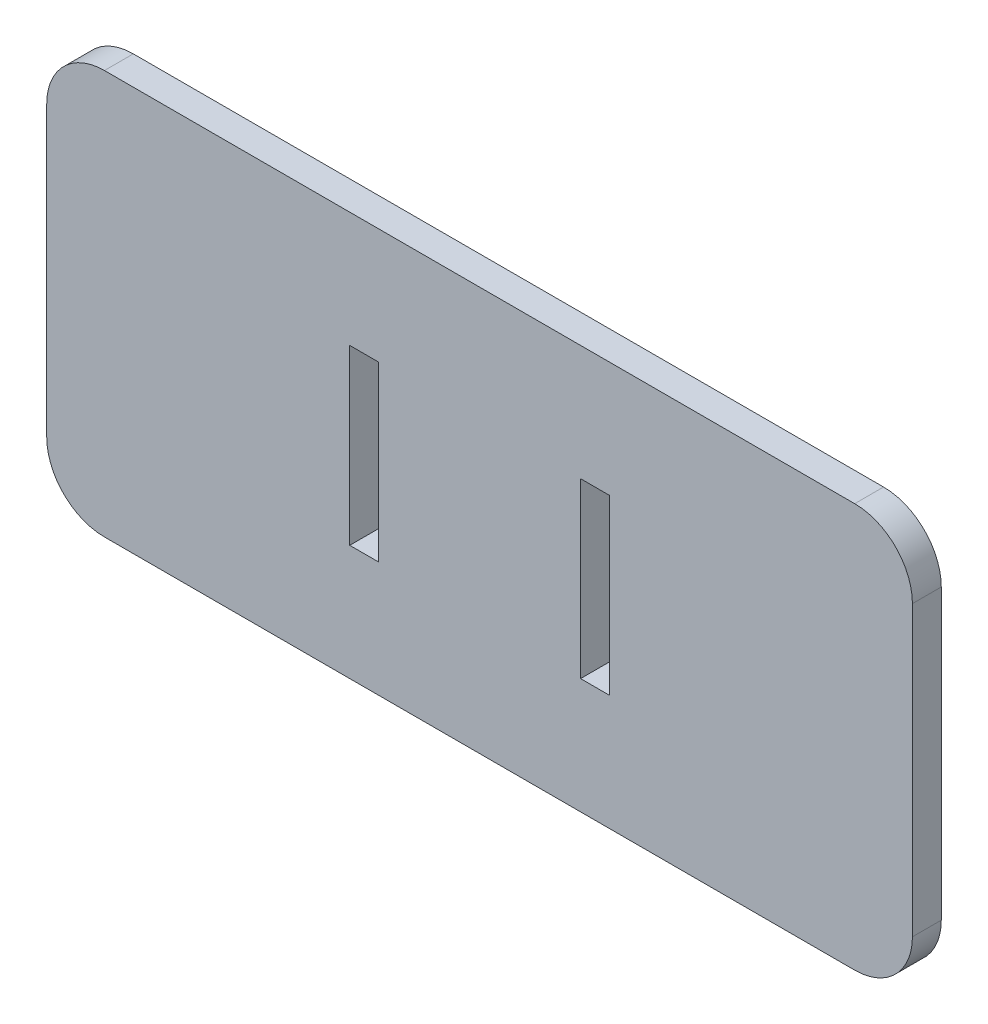
from build123d import *

# Parameters (mm, degrees)
BOSS_EXTRUDE1_DEPTH = 10
SKETCH2_W           = 10
SKETCH2_H           = 60
CUT_EXTRUDE1_DEPTH  = 10


with BuildPart() as part:
    # Sketch1 → Boss-Extrude1 (new body)
    with BuildSketch(Plane.XY):
        with BuildLine():
            Line((80, 40), (-180, 40))
            ThreePointArc((-180, 40), (-194.142135624, 34.142135624), (-200, 20))
            Line((-200, 20), (-200, -80))
            ThreePointArc((-200, -80), (-194.142135624, -94.142135624), (-180, -100))
            Line((-180, -100), (80, -100))
            ThreePointArc((80, -100), (94.142135624, -94.142135624), (100, -80))
            Line((100, -80), (100, 20))
            ThreePointArc((100, 20), (94.142135624, 34.142135624), (80, 40))
        make_face()
    extrude(amount=BOSS_EXTRUDE1_DEPTH)

    # Sketch2 → Cut-Extrude1 (cut)
    with BuildSketch(Plane.XY.offset(10)):
        with Locations((-90, -30)):
            Rectangle(SKETCH2_W, SKETCH2_H)
        with Locations((-10, -30)):
            Rectangle(SKETCH2_W, SKETCH2_H)
    extrude(amount=-CUT_EXTRUDE1_DEPTH, mode=Mode.SUBTRACT)


solid = part.part
